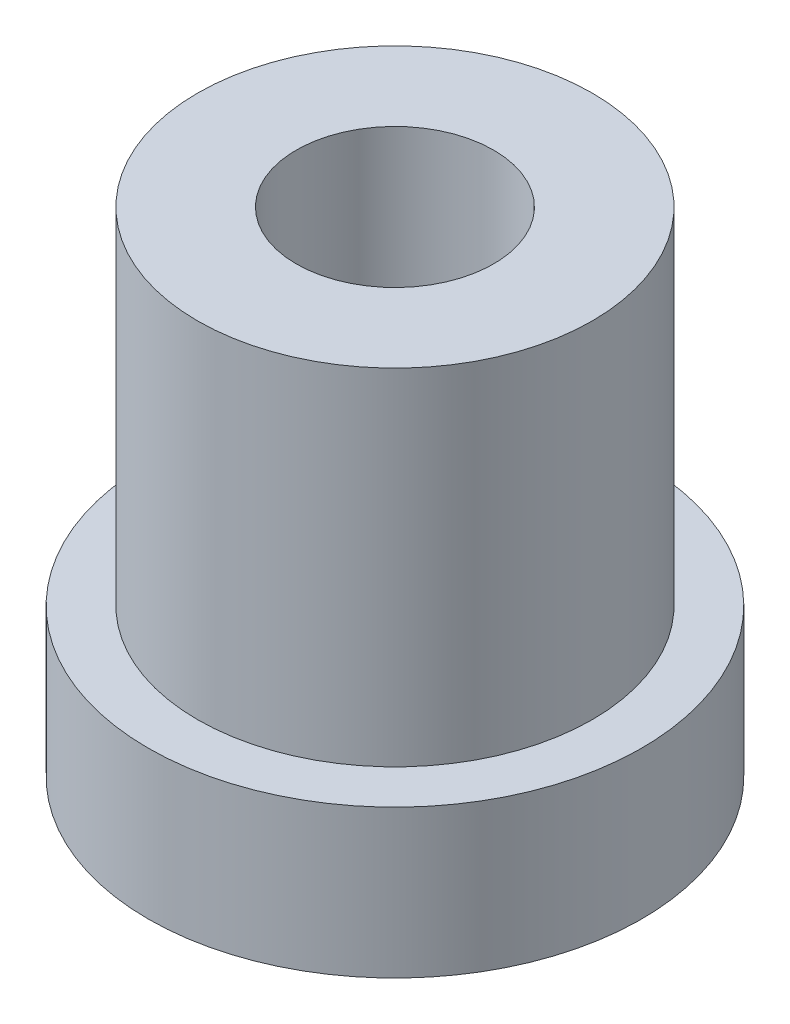
from build123d import *

# Parameters (mm, degrees)
SKETCH2_R           = 8
BOSS_EXTRUDE1_DEPTH = 20
SKETCH3_R           = 10
BOSS_EXTRUDE2_DEPTH = 6
SKETCH1_R           = 4
CUT_EXTRUDE1_DEPTH  = 25.494897428


with BuildPart() as part:
    # Sketch2 → Boss-Extrude1 (new body)
    with BuildSketch(Plane(origin=(0, 0, 0), x_dir=(1, 0, 0), z_dir=(0, 1, 0))):
        Circle(SKETCH2_R)
    extrude(amount=BOSS_EXTRUDE1_DEPTH)

    # Sketch3 → Boss-Extrude2 (add)
    with BuildSketch(Plane(origin=(0, 0, 0), x_dir=(1, 0, 0), z_dir=(0, 1, 0))):
        Circle(SKETCH3_R)
    extrude(amount=BOSS_EXTRUDE2_DEPTH)

    # Sketch1 → Cut-Extrude1 (cut, through all)
    with BuildSketch(Plane(origin=(0, 0, 0), x_dir=(1, 0, 0), z_dir=(0, 1, 0))):
        Circle(SKETCH1_R)
    extrude(amount=CUT_EXTRUDE1_DEPTH, mode=Mode.SUBTRACT)


solid = part.part
